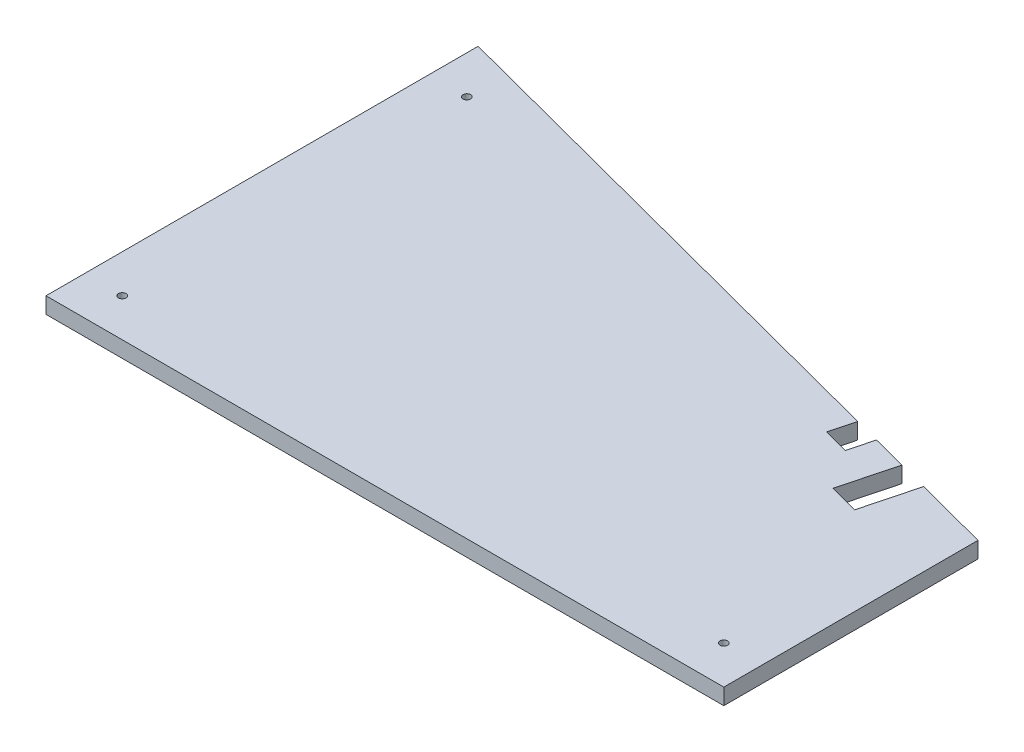
from build123d import *

# Parameters (mm, degrees)
BOSS_EXTRUDE1_DEPTH = 6.35
SKETCH3_R           = 1.5
CUT_EXTRUDE1_DEPTH  = 317.295028415


with BuildPart() as part:
    # Sketch2 → Boss-Extrude1 (new body)
    with BuildSketch(Plane(origin=(0, 0, 0), x_dir=(1, 0, 0), z_dir=(0, 1, 0))):
        Polygon((0, 0), (266.65, 0), (266.65, 100), (237.633187959, 107.617389248), (231.996319915, 86.144948337), (220.389595099, 89.191904036), (226.026463142, 110.664344947), (212.485284189, 114.219126596), (209.94615444, 104.546855915), (199.94615444, 107.172019988), (202.485284189, 116.844290668), (0, 170), align=None)
    extrude(amount=BOSS_EXTRUDE1_DEPTH)

    # Sketch3 → Cut-Extrude1 (cut, through all)
    with BuildSketch(Plane(origin=(0, 6.35, 0), x_dir=(1, 0, 0), z_dir=(0, 1, 0))):
        with Locations((15, 150.554003041)):
            Circle(SKETCH3_R)
        with Locations((15, 15)):
            Circle(SKETCH3_R)
        with Locations((251.65, 15)):
            Circle(SKETCH3_R)
    extrude(amount=-CUT_EXTRUDE1_DEPTH, mode=Mode.SUBTRACT)


solid = part.part
